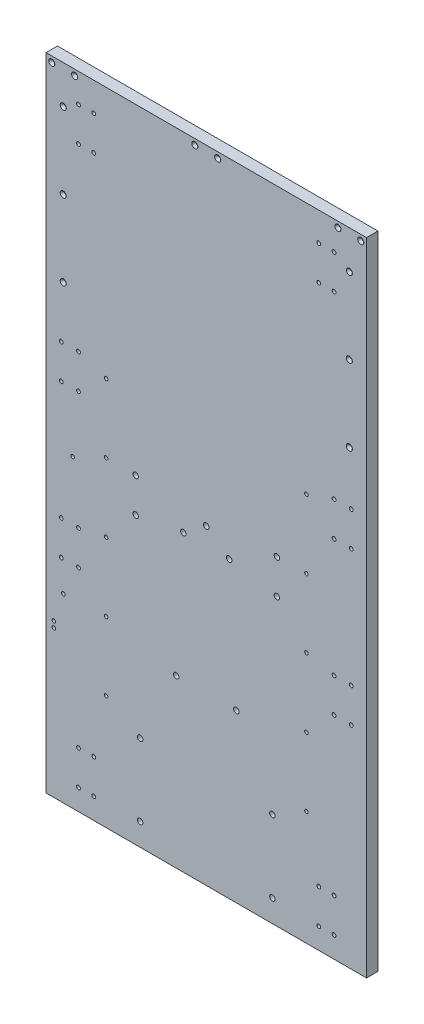
from build123d import *

# Parameters (mm, degrees)
SKETCH1_W                        = 533.146
SKETCH1_H                        = 1066.799994849
BOSS_EXTRUDE1_DEPTH              = 19.05
F_23_64_0_35938_DIAMETER_HOLE1_D = 9.128252
F_15_64_0_23438_DIAMETER_HOLE1_D = 5.953252
F_1_4_0_25_DIAMETER_HOLE1_D      = 6.35
F_15_64_0_23438_DIAMETER_HOLE2_D = 5.953252
HOLE1_D                          = 3.175
HOLE1_DEPTH                      = 38.1
HOLE1_CSINK_D                    = 10.16
HOLE1_CSINK_ANGLE                = 82
HOLE1_TIP                        = 0.953866233


with BuildPart() as part:
    # Sketch1 → Boss-Extrude1 (new body)
    with BuildSketch(Plane.XY):
        with Locations((0, 6469.379997497)):
            Rectangle(SKETCH1_W, SKETCH1_H)
    extrude(amount=-BOSS_EXTRUDE1_DEPTH)

    # 23/64 (0.35938) Diameter Hole1 (through all)
    with Locations(Plane(origin=(0, 0, -19.05), x_dir=(-1, 0, 0), z_dir=(0, 0, -1))):
        with Locations((110, 5973.262000072), (110, 6093.262000072), (-110, 6093.262000072), (-110, 5973.262000072), (-50, 6213.262000072), (50, 6213.262000072), (-117.475, 6411.087000072), (-117.475, 6468.237000072), (117.475, 6411.087000072), (117.475, 6468.237000072), (-38.1, 6425.374500072), (0, 6453.949500072), (38.1, 6425.374500072)):
            Hole(F_23_64_0_35938_DIAMETER_HOLE1_D / 2)

    # 15/64 (0.23438) Diameter Hole1 (through all)
    with Locations(Plane(origin=(0, 0, -19.05), x_dir=(-1, 0, 0), z_dir=(0, 0, -1))):
        with Locations((166.6875, 6125.895804781), (166.6875, 6240.195804781), (166.6875, 6354.495804781), (166.6875, 6468.795804781), (166.6875, 6583.095804781), (-166.6875, 6125.895804781), (-166.6875, 6240.195804781), (-166.6875, 6354.495804781), (-166.6875, 6468.795804781), (-166.6875, 6583.095804781)):
            Hole(F_15_64_0_23438_DIAMETER_HOLE1_D / 2)

    # 1/4 (0.25) Diameter Hole1 (through all)
    with Locations(Plane.XY):
        with Locations((-212.598, 6955.154994921), (-212.598, 6898.004994921), (-187.198, 6898.004994921), (-187.198, 6955.154994921), (-241.173, 6598.970804781), (-241.173, 6541.820804781), (-212.598, 6541.820804781), (-212.598, 6598.970804781), (-212.598, 6344.970804781), (-241.173, 6344.970804781), (-241.173, 6287.820804781), (-212.598, 6287.820804781), (-212.598, 6028.055000072), (-187.198, 6028.055000072), (-187.198, 5970.905000072), (-212.598, 5970.905000072), (212.598, 5970.905000072), (187.198, 5970.905000072), (187.198, 6028.055000072), (212.598, 6028.055000072), (212.598, 6287.820804781), (241.173, 6287.820804781), (241.173, 6344.970804781), (212.598, 6344.970804781), (212.598, 6598.970804781), (212.598, 6541.820804781), (241.173, 6541.820804781), (241.173, 6598.970804781), (187.198, 6955.154994921), (187.198, 6898.004994921), (212.598, 6898.004994921), (212.598, 6955.154994921)):
            Hole(F_1_4_0_25_DIAMETER_HOLE1_D / 2)

    # 15/64 (0.23438) Diameter Hole2 (through all)
    with Locations(Plane(origin=(0, 0, -19.05), x_dir=(-1, 0, 0), z_dir=(0, 0, -1))):
        with Locations((222.123, 6442.787309643), (253.823, 6180.329994921), (253.823, 6190.329994921), (237.948, 6237.312899851)):
            Hole(F_15_64_0_23438_DIAMETER_HOLE2_D / 2)

    # Hole1
    with Locations(Plane.XY):
        with Locations((-237.998, 6686.191891629), (237.998, 6686.191891629), (257.048, 6993.254994921), (218.948, 6993.254994921), (19.05, 6993.254994921), (237.998, 6939.279994921), (237.998, 6812.735943275), (-237.998, 6812.735943275), (-237.998, 6939.279994921), (-19.05, 6993.254994921), (-218.948, 6993.254994921), (-257.048, 6993.254994921)):
            CounterSinkHole(HOLE1_D / 2, HOLE1_CSINK_D / 2, depth=HOLE1_DEPTH, counter_sink_angle=HOLE1_CSINK_ANGLE)
            with Locations((0, 0, -(HOLE1_DEPTH + HOLE1_TIP / 2))):  # 118° drill point
                Cone(0, HOLE1_D / 2, HOLE1_TIP, mode=Mode.SUBTRACT)


solid = part.part
